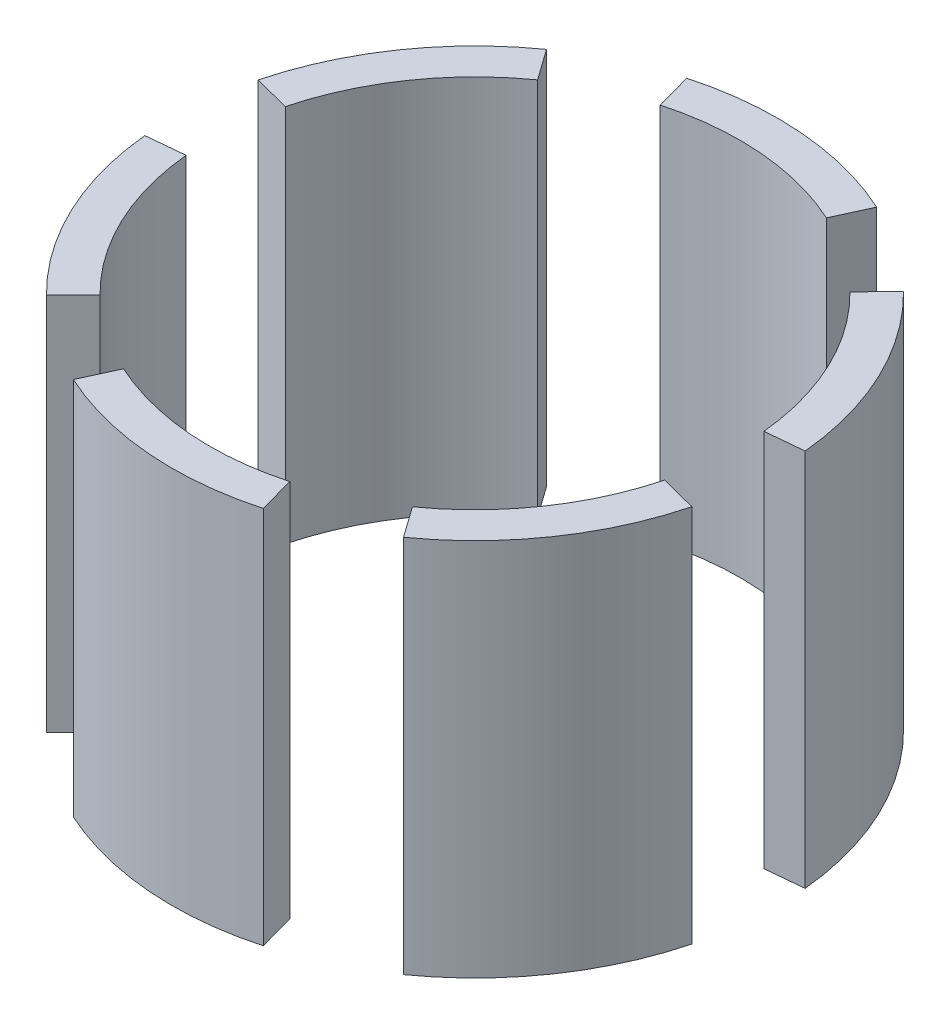
from build123d import *

# Parameters (mm, degrees)
BOSS_EXTRUDE2_DEPTH   = 25
BOSS_EXTRUDE2_2_DEPTH = 25
BOSS_EXTRUDE2_3_DEPTH = 25
BOSS_EXTRUDE2_4_DEPTH = 25
BOSS_EXTRUDE2_5_DEPTH = 25
BOSS_EXTRUDE2_6_DEPTH = 25
SKETCH7_R             = 17.5
CUT_EXTRUDE1_DEPTH    = 25


with BuildPart() as part:
    # Sketch6 → Boss-Extrude2 (new body)
    with BuildSketch(Plane(origin=(0, 0, 0), x_dir=(1, 0, 0), z_dir=(0, 1, 0))):
        with BuildLine():
            Line((-14.044167224, -14.239430009), (0, 0))
            Line((0, 0), (-19.911385439, -1.880619552))
            ThreePointArc((-19.911385439, -1.880619552), (-18.067372198, -8.577299217), (-14.044167224, -14.239430009))
        make_face()
    extrude(amount=BOSS_EXTRUDE2_DEPTH)


with BuildPart() as body_2:
    # Sketch6 → Boss-Extrude2 2 (new body)
    with BuildSketch(Plane(origin=(0, 0, 0), x_dir=(1, 0, 0), z_dir=(0, 1, 0))):
        with BuildLine():
            Line((-19.353791735, 5.042890586), (0, 0))
            Line((0, 0), (-11.584357027, 16.303455839))
            ThreePointArc((-11.584357027, 16.303455839), (-16.461845117, 11.358153694), (-19.353791735, 5.042890586))
        make_face()
    extrude(amount=BOSS_EXTRUDE2_2_DEPTH)


with BuildPart() as body_3:
    # Sketch6 → Boss-Extrude2 3 (new body)
    with BuildSketch(Plane(origin=(0, 0, 0), x_dir=(1, 0, 0), z_dir=(0, 1, 0))):
        with BuildLine():
            Line((-5.309624512, 19.282320595), (0, 0))
            Line((0, 0), (8.327028412, 18.184075391))
            ThreePointArc((8.327028412, 18.184075391), (1.605527081, 19.935452912), (-5.309624512, 19.282320595))
        make_face()
    extrude(amount=BOSS_EXTRUDE2_3_DEPTH)


with BuildPart() as body_4:
    # Sketch6 → Boss-Extrude2 4 (new body)
    with BuildSketch(Plane(origin=(0, 0, 0), x_dir=(1, 0, 0), z_dir=(0, 1, 0))):
        with BuildLine():
            Line((14.044167224, 14.239430009), (0, 0))
            Line((0, 0), (19.911385439, 1.880619552))
            ThreePointArc((19.911385439, 1.880619552), (18.067372198, 8.577299217), (14.044167224, 14.239430009))
        make_face()
    extrude(amount=BOSS_EXTRUDE2_4_DEPTH)


with BuildPart() as body_5:
    # Sketch6 → Boss-Extrude2 5 (new body)
    with BuildSketch(Plane(origin=(0, 0, 0), x_dir=(1, 0, 0), z_dir=(0, 1, 0))):
        with BuildLine():
            Line((19.353791735, -5.042890586), (0, 0))
            Line((0, 0), (11.584357027, -16.303455839))
            ThreePointArc((11.584357027, -16.303455839), (16.461845117, -11.358153694), (19.353791735, -5.042890586))
        make_face()
    extrude(amount=BOSS_EXTRUDE2_5_DEPTH)


with BuildPart() as body_6:
    # Sketch6 → Boss-Extrude2 6 (new body)
    with BuildSketch(Plane(origin=(0, 0, 0), x_dir=(1, 0, 0), z_dir=(0, 1, 0))):
        with BuildLine():
            Line((0, 0), (-8.327028412, -18.184075391))
            ThreePointArc((-8.327028412, -18.184075391), (-1.605527081, -19.935452912), (5.309624512, -19.282320595))
            Line((5.309624512, -19.282320595), (0, 0))
        make_face()
    extrude(amount=BOSS_EXTRUDE2_6_DEPTH)


with BuildPart() as cut_extrude1_tool:
    # Sketch7 → Cut-Extrude1 (new body)
    with BuildSketch(Plane(origin=(0, 0, 0), x_dir=(1, 0, 0), z_dir=(0, 1, 0))):
        Circle(SKETCH7_R)
    extrude(amount=CUT_EXTRUDE1_DEPTH)


with BuildPart() as part_1:
    add(part.part)

    # Cut-Extrude1: cut by cut_extrude1_tool
    add(cut_extrude1_tool.part, mode=Mode.SUBTRACT)


with BuildPart() as body_2_1:
    add(body_2.part)

    # Cut-Extrude1: cut by cut_extrude1_tool
    add(cut_extrude1_tool.part, mode=Mode.SUBTRACT)


with BuildPart() as body_3_1:
    add(body_3.part)

    # Cut-Extrude1: cut by cut_extrude1_tool
    add(cut_extrude1_tool.part, mode=Mode.SUBTRACT)


with BuildPart() as body_4_1:
    add(body_4.part)

    # Cut-Extrude1: cut by cut_extrude1_tool
    add(cut_extrude1_tool.part, mode=Mode.SUBTRACT)


with BuildPart() as body_5_1:
    add(body_5.part)

    # Cut-Extrude1: cut by cut_extrude1_tool
    add(cut_extrude1_tool.part, mode=Mode.SUBTRACT)


with BuildPart() as body_6_1:
    add(body_6.part)

    # Cut-Extrude1: cut by cut_extrude1_tool
    add(cut_extrude1_tool.part, mode=Mode.SUBTRACT)


solid = Compound([part_1.part, body_2_1.part, body_3_1.part, body_4_1.part, body_5_1.part, body_6_1.part])
